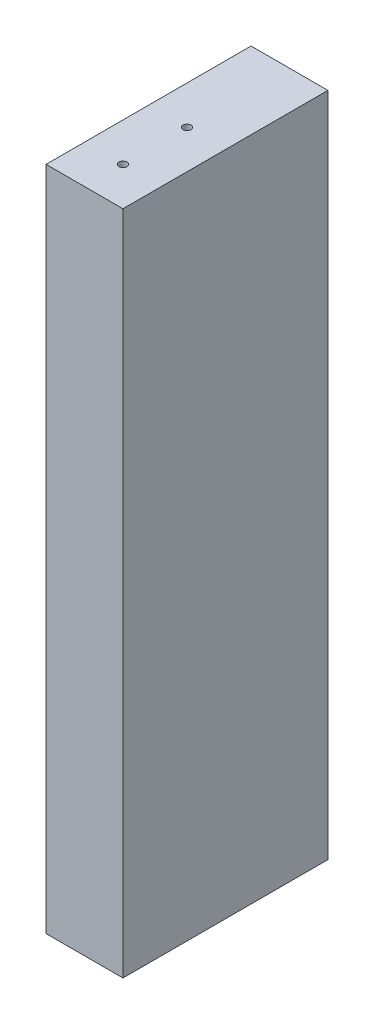
from build123d import *

# Parameters (mm, degrees)
SKETCH1_W                           = 19.05
SKETCH1_H                           = 165.099999729
BOSS_EXTRUDE1_DEPTH                 = 50.8
F_5_64_0_07813_DIAMETER_HOLE1_D     = 1.984502
F_5_64_0_07813_DIAMETER_HOLE1_DEPTH = 38.1
F_5_64_0_07813_DIAMETER_HOLE1_TIP   = 0.59620455
F_5_64_0_07813_DIAMETER_HOLE2_D     = 1.984502
F_5_64_0_07813_DIAMETER_HOLE2_DEPTH = 19.05
F_5_64_0_07813_DIAMETER_HOLE2_TIP   = 0.59620455
F_5_64_0_07813_DIAMETER_HOLE3_D     = 1.984502
F_5_64_0_07813_DIAMETER_HOLE3_DEPTH = 19.05
F_5_64_0_07813_DIAMETER_HOLE3_TIP   = 0.59620455


with BuildPart() as part:
    # Sketch1 → Boss-Extrude1 (new body)
    with BuildSketch(Plane.XY):
        with Locations((440.567640906, 6183.630000136)):
            Rectangle(SKETCH1_W, SKETCH1_H)
    extrude(amount=BOSS_EXTRUDE1_DEPTH)

    # 5/64 (0.07813) Diameter Hole1
    with Locations(Plane(origin=(4.968994719, 3.22e-07, -19.050107671), x_dir=(-1, 0, 0), z_dir=(0, 1.37705190708017e-10, -1.0))):
        with Locations((-481.589248274, 6993.254992531), (-386.339248274, 6993.254992531), (-291.089248274, 6993.254992531), (-295.274999999, 6965.135938475), (-295.274999999, 6812.735938475), (-295.274999999, 6660.335938474), (-285.166362357, 6631.468843414), (-475.477307398, 6631.468752771), (-485.002307398, 6660.335938474), (-485.002307398, 6812.735938474), (-485.002307398, 6965.135938474), (-478.365617646, 6611.6708), (-287.865617646, 6611.6708), (-307.975, 6564.3379), (-307.975, 6488.1379), (-284.960913066, 6440.805), (-380.210913066, 6440.805), (-475.460913066, 6440.805), (-446.831312422, 6488.1379), (-446.831312422, 6564.3379), (-472.231312422, 6396.355), (-472.231312422, 6320.155), (-472.653156211, 6275.705000839), (-377.403156211, 6275.705000839), (-282.153156211, 6275.705000839), (-282.575, 6320.155), (-282.575, 6396.355), (-435.598646187, 6221.729999816), (-435.598646187, 6145.529999816), (-450.592518112, 6091.554999951), (-460.998646187, 6091.555478285), (-460.998646187, 6056.629999944), (-460.998646187, 5980.429999944), (-460.998646187, 5945.505000042), (-282.153156211, 5945.505000042), (-368.611823093, 5945.505000042)):
            Hole(F_5_64_0_07813_DIAMETER_HOLE1_D / 2, depth=F_5_64_0_07813_DIAMETER_HOLE1_DEPTH)
            with Locations((0, 0, -(F_5_64_0_07813_DIAMETER_HOLE1_DEPTH + F_5_64_0_07813_DIAMETER_HOLE1_TIP / 2))):  # 118° drill point
                Cone(0, F_5_64_0_07813_DIAMETER_HOLE1_D / 2, F_5_64_0_07813_DIAMETER_HOLE1_TIP, mode=Mode.SUBTRACT)

    # 5/64 (0.07813) Diameter Hole2
    with Locations(Plane(origin=(0, 6101.080000271, 0), x_dir=(-1, 0, 0), z_dir=(0, -1, 0))):
        with Locations((-440.567640906, -41.274956045), (-440.567640906, -25.399956045)):
            Hole(F_5_64_0_07813_DIAMETER_HOLE2_D / 2, depth=F_5_64_0_07813_DIAMETER_HOLE2_DEPTH)
            with Locations((0, 0, -(F_5_64_0_07813_DIAMETER_HOLE2_DEPTH + F_5_64_0_07813_DIAMETER_HOLE2_TIP / 2))):  # 118° drill point
                Cone(0, F_5_64_0_07813_DIAMETER_HOLE2_D / 2, F_5_64_0_07813_DIAMETER_HOLE2_TIP, mode=Mode.SUBTRACT)

    # 5/64 (0.07813) Diameter Hole3
    with Locations(Plane(origin=(0, 6266.18, 0), x_dir=(1, 0, 0), z_dir=(0, 1, 0))):
        with Locations((440.567640906, -25.399956045), (440.567640906, -41.274956045)):
            Hole(F_5_64_0_07813_DIAMETER_HOLE3_D / 2, depth=F_5_64_0_07813_DIAMETER_HOLE3_DEPTH)
            with Locations((0, 0, -(F_5_64_0_07813_DIAMETER_HOLE3_DEPTH + F_5_64_0_07813_DIAMETER_HOLE3_TIP / 2))):  # 118° drill point
                Cone(0, F_5_64_0_07813_DIAMETER_HOLE3_D / 2, F_5_64_0_07813_DIAMETER_HOLE3_TIP, mode=Mode.SUBTRACT)


solid = part.part
